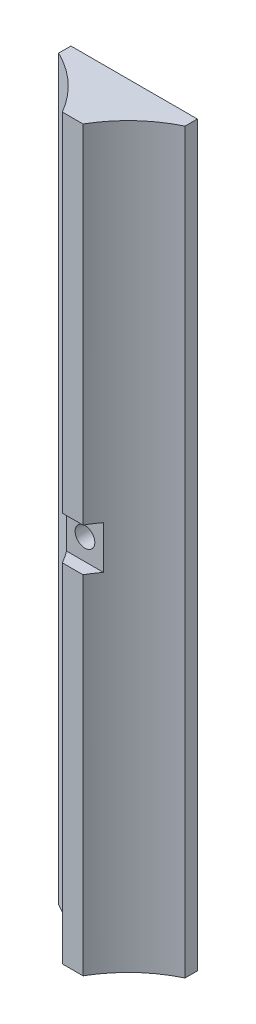
from build123d import *

# Parameters (mm, degrees)
BOSS_EXTRUDE1_DEPTH   = 30
M2X0_4_TAPPED_HOLE1_D = 1.6
SKETCH7_W             = 9.56231658
SKETCH7_H             = 3.5
CUT_EXTRUDE1_DEPTH    = 1


with BuildPart() as part:
    # Sketch1 → Boss-Extrude1 (new, symmetric)
    with BuildSketch(Plane(origin=(0, 0, 0), x_dir=(1, 0, 0), z_dir=(0, 1, 0))):
        with BuildLine():
            Line((-0.839745962, 0), (0.839745962, 0))
            ThreePointArc((0.839745962, 0), (2.690111154, 2.322937519), (5.141101056, 4))
            Line((5.141101056, 4), (5.141101056, 5))
            Line((5.141101056, 5), (-5.141101056, 5))
            Line((-5.141101056, 5), (-5.141101056, 4))
            ThreePointArc((-5.141101056, 4), (-2.690111154, 2.322937519), (-0.839745962, 0))
        make_face()
    extrude(amount=BOSS_EXTRUDE1_DEPTH, both=True)

    # M2x0.4 Tapped Hole1 (through all)
    with Locations(Plane(origin=(0, 0, -5), x_dir=(-1, 0, 0), z_dir=(0, 0, -1))):
        with Locations((0, 0)):
            Hole(M2X0_4_TAPPED_HOLE1_D / 2)

    # Sketch7 → Cut-Extrude1 (cut)
    with BuildSketch(Plane.XY):
        with Locations((-0.359942766, 0)):
            Rectangle(SKETCH7_W, SKETCH7_H)
    extrude(amount=-CUT_EXTRUDE1_DEPTH, mode=Mode.SUBTRACT)


solid = part.part
